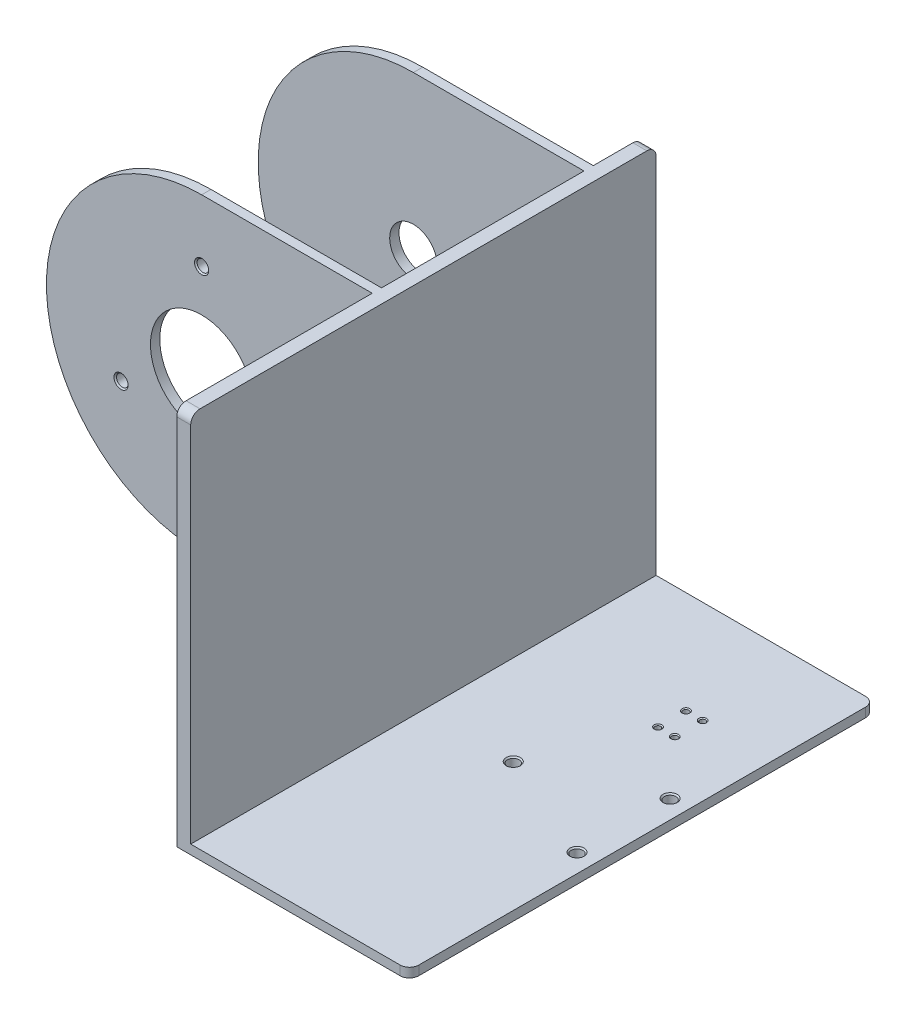
from build123d import *

# Parameters (mm, degrees)
SKETCH_1_W                   = 50
SKETCH_1_H                   = 100
EXTRUDE_1_DEPTH              = 2
SKETCH_2_W                   = 3
SKETCH_2_H                   = 100
EXTRUDE_2_DEPTH              = 80
SKETCH_3_W                   = 2
SKETCH_3_H                   = 66.7
EXTRUDE_3_DEPTH              = 70
CUT_EXTRUDE_4_REACH          = 162.465
SKETCH_8_W                   = 2
SKETCH_8_H                   = 66.7
EXTRUDE_4_DEPTH              = 70
CUT_EXTRUDE_5_REACH          = 140.25
HOLE_WIZARD_M3_1_D           = 2.5
HOLE_WIZARD_M3_1_DEPTH       = 2
HOLE_WIZARD_M3_1_CSINK_D     = 3.05
HOLE_WIZARD_M3_1_CSINK_ANGLE = 90
FILLET_1_R                   = 2
CUT_EXTRUDE_6_REACH          = 140.25
SKETCH_12_R                  = 11
CUT_EXTRUDE_7_REACH          = 162.465
SKETCH_13_R                  = 14.5
SKETCH_14_W                  = 2
SKETCH_14_H                  = 66.7
EXTRUDE_5_DEPTH              = 70
CUT_EXTRUDE_8_REACH          = 156.14
SKETCH_15_R                  = 5.1
CUT_EXTRUDE_9_DEPTH          = 155.140358116
CUT_EXTRUDE_9_DEPTH_BACK     = 155.140358116
SKETCH_19_W                  = 2
SKETCH_19_H                  = 66.7
CUT_EXTRUDE_10_DEPTH         = 119.844436134
FILLET_2_R                   = 2
HOLE_WIZARD_M3_3_D           = 2.5
HOLE_WIZARD_M3_3_CSINK_D     = 3.05
HOLE_WIZARD_M3_3_CSINK_ANGLE = 90


# Read off the part's stored shape, not the designer's step: M1.6 螺纹孔1, M1.6 螺纹孔2
with BuildPart() as part:
    # 草图1 → 凸台-拉伸1 (new body)
    with BuildSketch(Plane(origin=(0, 0, 0), x_dir=(1, 0, 0), z_dir=(0, 1, 0))):
        Rectangle(SKETCH_1_W, SKETCH_1_H)
    extrude(amount=EXTRUDE_1_DEPTH)

    # 草图2 → 凸台-拉伸2 (add)
    with BuildSketch(Plane(origin=(0, 2, 0), x_dir=(1, 0, 0), z_dir=(0, 1, 0))):
        with Locations((-23.5, 0)):
            Rectangle(SKETCH_2_W, SKETCH_2_H)
    extrude(amount=EXTRUDE_2_DEPTH)

    # 草图3 → 凸台-拉伸3 (add)
    with BuildSketch(Plane.ZY.offset(25)):
        with Locations((-49, 48.65)):
            Rectangle(SKETCH_3_W, SKETCH_3_H)
    extrude(amount=EXTRUDE_3_DEPTH)

    # 草图4 → 切除-拉伸4 (cut, up to next)
    with BuildSketch(Plane(origin=(0, 0, -50), x_dir=(-1, 0, 0), z_dir=(0, 0, -1)), mode=Mode.PRIVATE) as cut_extrude_4_sk1:
        with BuildLine():
            Line((95, 82), (61.65, 82))
            ThreePointArc((61.65, 82), (85.232011153, 72.232011153), (95, 48.65))
            Line((95, 48.65), (95, 82))
        make_face()
    cut_extrude_4_tool1 = extrude(cut_extrude_4_sk1.sketch, amount=-CUT_EXTRUDE_4_REACH, mode=Mode.PRIVATE) & part.part
    # 草图4 → 切除-拉伸4 (cut, up to next)
    with BuildSketch(Plane(origin=(0, 0, -50), x_dir=(-1, 0, 0), z_dir=(0, 0, -1)), mode=Mode.PRIVATE) as cut_extrude_4_sk2:
        with BuildLine():
            ThreePointArc((95, 48.65), (85.232011153, 25.067988847), (61.65, 15.3))
            Line((61.65, 15.3), (95, 15.3))
            Line((95, 15.3), (95, 48.65))
        make_face()
    cut_extrude_4_tool2 = extrude(cut_extrude_4_sk2.sketch, amount=-CUT_EXTRUDE_4_REACH, mode=Mode.PRIVATE) & part.part
    add(cut_extrude_4_tool1.solids().sort_by_distance((-87.550679, 74.550679, -50))[0], mode=Mode.SUBTRACT)
    add(cut_extrude_4_tool2.solids().sort_by_distance((-87.550679, 22.749321, -50))[0], mode=Mode.SUBTRACT)

    # 草图8 → 凸台-拉伸4 (add)
    with BuildSketch(Plane.ZY.offset(25)):
        with Locations((7, 48.65)):
            Rectangle(SKETCH_8_W, SKETCH_8_H)
    extrude(amount=EXTRUDE_4_DEPTH)

    # 草图9 → 切除-拉伸5 (cut, up to next)
    with BuildSketch(Plane.XY.offset(8), mode=Mode.PRIVATE) as cut_extrude_5_sk1:
        with BuildLine():
            ThreePointArc((-95, 48.65), (-85.232011153, 72.232011153), (-61.65, 82))
            Line((-61.65, 82), (-95, 82))
            Line((-95, 82), (-95, 48.65))
        make_face()
    cut_extrude_5_tool1 = extrude(cut_extrude_5_sk1.sketch, amount=-CUT_EXTRUDE_5_REACH, mode=Mode.PRIVATE) & part.part
    # 草图9 → 切除-拉伸5 (cut, up to next)
    with BuildSketch(Plane.XY.offset(8), mode=Mode.PRIVATE) as cut_extrude_5_sk2:
        with BuildLine():
            ThreePointArc((-61.65, 15.3), (-85.232011153, 25.067988847), (-95, 48.65))
            Line((-95, 48.65), (-95, 15.3))
            Line((-95, 15.3), (-61.65, 15.3))
        make_face()
    cut_extrude_5_tool2 = extrude(cut_extrude_5_sk2.sketch, amount=-CUT_EXTRUDE_5_REACH, mode=Mode.PRIVATE) & part.part
    add(cut_extrude_5_tool1.solids().sort_by_distance((-87.550679, 74.550679, 8))[0], mode=Mode.SUBTRACT)
    add(cut_extrude_5_tool2.solids().sort_by_distance((-87.550679, 22.749321, 8))[0], mode=Mode.SUBTRACT)

    # M3 螺纹孔1
    with Locations(Plane.XY.offset(8)):
        with Locations((-78.970508076, 38.65), (-61.65, 68.65), (-44.329491924, 38.65)):
            CounterSinkHole(HOLE_WIZARD_M3_1_D / 2, HOLE_WIZARD_M3_1_CSINK_D / 2, depth=HOLE_WIZARD_M3_1_DEPTH, counter_sink_angle=HOLE_WIZARD_M3_1_CSINK_ANGLE)

    # 圆角1
    fillet_1_edges = [part.edges().sort_by_distance(p)[0] for p in [
        (-23.5, 82, 50),
        (25, 1, 50),
        (25, 1, -50),
    ]]
    fillet(fillet_1_edges, radius=FILLET_1_R)

    # 草图12 → 切除-拉伸6 (cut, up to next)
    with BuildSketch(Plane.XY.offset(8), mode=Mode.PRIVATE) as cut_extrude_6_sk1:
        with Locations((-61.65, 48.65)):
            Circle(SKETCH_12_R)
    cut_extrude_6_tool1 = extrude(cut_extrude_6_sk1.sketch, amount=-CUT_EXTRUDE_6_REACH, mode=Mode.PRIVATE) & part.part
    add(cut_extrude_6_tool1.solids().sort_by_distance((-61.65, 48.65, 8))[0], mode=Mode.SUBTRACT)

    # 草图13 → 切除-拉伸7 (cut, up to next)
    with BuildSketch(Plane(origin=(0, 0, -50), x_dir=(-1, 0, 0), z_dir=(0, 0, -1)), mode=Mode.PRIVATE) as cut_extrude_7_sk1:
        with Locations((61.65, 48.65)):
            Circle(SKETCH_13_R)
    cut_extrude_7_tool1 = extrude(cut_extrude_7_sk1.sketch, amount=-CUT_EXTRUDE_7_REACH, mode=Mode.PRIVATE) & part.part
    add(cut_extrude_7_tool1.solids().sort_by_distance((-61.65, 48.65, -50))[0], mode=Mode.SUBTRACT)

    # 草图14 → 凸台-拉伸5 (add)
    with BuildSketch(Plane.ZY.offset(25)):
        with Locations((-38.5, 48.65)):
            Rectangle(SKETCH_14_W, SKETCH_14_H)
    extrude(amount=EXTRUDE_5_DEPTH)

    # 草图15 → 切除-拉伸8 (cut, up to next)
    with BuildSketch(Plane(origin=(0, 0, -39.5), x_dir=(-1, 0, 0), z_dir=(0, 0, -1)), mode=Mode.PRIVATE) as cut_extrude_8_sk1:
        with Locations(Location((61.65, 48.65, 0), (0, 0, 90))):
            Circle(SKETCH_15_R)
    cut_extrude_8_tool1 = extrude(cut_extrude_8_sk1.sketch, amount=-CUT_EXTRUDE_8_REACH, mode=Mode.PRIVATE) & part.part
    add(cut_extrude_8_tool1.solids().sort_by_distance((-61.65, 48.65, -39.5))[0], mode=Mode.SUBTRACT)

    # 草图18 → 切除-拉伸9 (cut, two sides: drawn at the far end of the back side and taken through both)
    with BuildSketch(Plane(origin=(0, 0, -39.5), x_dir=(-1, 0, 0), z_dir=(0, 0, -1)).offset(-CUT_EXTRUDE_9_DEPTH_BACK)):
        with BuildLine():
            Line((95, 15.3), (95, 48.65))
            ThreePointArc((95, 48.65), (85.232011153, 25.067988847), (61.65, 15.3))
            Line((61.65, 15.3), (95, 15.3))
        make_face()
        with BuildLine():
            Line((95, 48.65), (95, 82))
            Line((95, 82), (61.65, 82))
            ThreePointArc((61.65, 82), (85.232011153, 72.232011153), (95, 48.65))
        make_face()
    extrude(amount=CUT_EXTRUDE_9_DEPTH + CUT_EXTRUDE_9_DEPTH_BACK, mode=Mode.SUBTRACT)

    # 草图19 → 切除-拉伸10 (cut, through all)
    with BuildSketch(Plane.ZY.offset(25)):
        with Locations((-49, 48.65)):
            Rectangle(SKETCH_19_W, SKETCH_19_H)
    extrude(amount=CUT_EXTRUDE_10_DEPTH, mode=Mode.SUBTRACT)

    # 圆角2
    fillet_2_edges = [part.edges().sort_by_distance(p)[0] for p in [
        (-23.5, 82, -50),
    ]]
    fillet(fillet_2_edges, radius=FILLET_2_R)

    # M3 螺纹孔3 (through all)
    with Locations(Plane(origin=(0, 2, 0), x_dir=(1, 0, 0), z_dir=(0, 1, 0))):
        with Locations((-2.7, 0), (21, 10), (21, -10)):
            CounterSinkHole(HOLE_WIZARD_M3_3_D / 2, HOLE_WIZARD_M3_3_CSINK_D / 2, counter_sink_angle=HOLE_WIZARD_M3_3_CSINK_ANGLE)

    # M1.6 螺纹孔1 outline → M1.6 螺纹孔1 (revolve, cut)
    with BuildSketch(Plane(origin=(10, 0, -28), x_dir=(1, 0, 0), z_dir=(0, 0, 1))):
        Polygon((0, 0), (0.625, 0), (0.625, 1.8), (0.825, 2), (0, 2), align=None)
    revolve(axis=Axis((10, 0, -28), (0, 1, 0)), mode=Mode.SUBTRACT)

    # Hole Wizard M1.6 _1 2 outline → Hole Wizard M1.6 _1 2 (revolve, cut)
    with BuildSketch(Plane(origin=(6.4, 0, -28), x_dir=(1, 0, 0), z_dir=(0, 0, 1))):
        Polygon((0, 0), (0.625, 0), (0.625, 1.8), (0.825, 2), (0, 2), align=None)
    revolve(axis=Axis((6.4, 0, -28), (0, 1, 0)), mode=Mode.SUBTRACT)

    # M1.6 螺纹孔2 outline → M1.6 螺纹孔2 (revolve, cut)
    with BuildSketch(Plane(origin=(10, 0, -22), x_dir=(1, 0, 0), z_dir=(0, 0, 1))):
        Polygon((0, 0), (0.625, 0), (0.625, 1.8), (0.825, 2), (0, 2), align=None)
    revolve(axis=Axis((10, 0, -22), (0, 1, 0)), mode=Mode.SUBTRACT)

    # Hole Wizard M1.6 _2 2 outline → Hole Wizard M1.6 _2 2 (revolve, cut)
    with BuildSketch(Plane(origin=(6.4, 0, -22), x_dir=(1, 0, 0), z_dir=(0, 0, 1))):
        Polygon((0, 0), (0.625, 0), (0.625, 1.8), (0.825, 2), (0, 2), align=None)
    revolve(axis=Axis((6.4, 0, -22), (0, 1, 0)), mode=Mode.SUBTRACT)


solid = part.part
